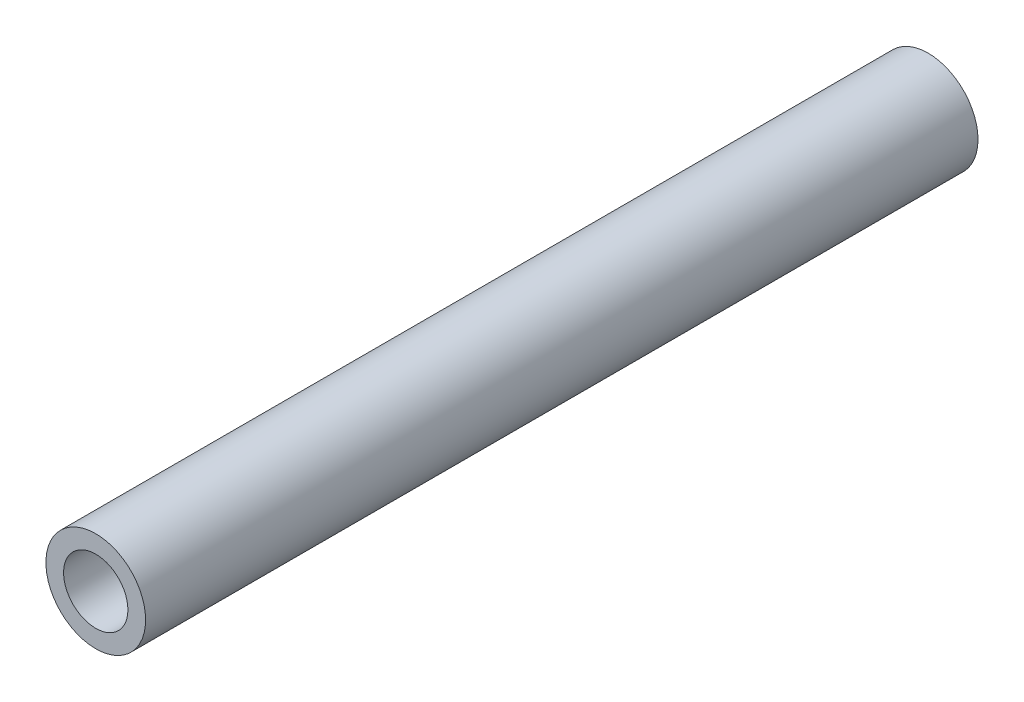
from build123d import *

# Parameters (mm, degrees)
SKETCH1_R           = 4
SKETCH1_R_2         = 2.58037788
BOSS_EXTRUDE1_DEPTH = 66.802


with BuildPart() as part:
    # Sketch1 → Boss-Extrude1 (new body)
    with BuildSketch(Plane.XY):
        Circle(SKETCH1_R)
        Circle(SKETCH1_R_2, mode=Mode.SUBTRACT)
    extrude(amount=BOSS_EXTRUDE1_DEPTH)


solid = part.part
